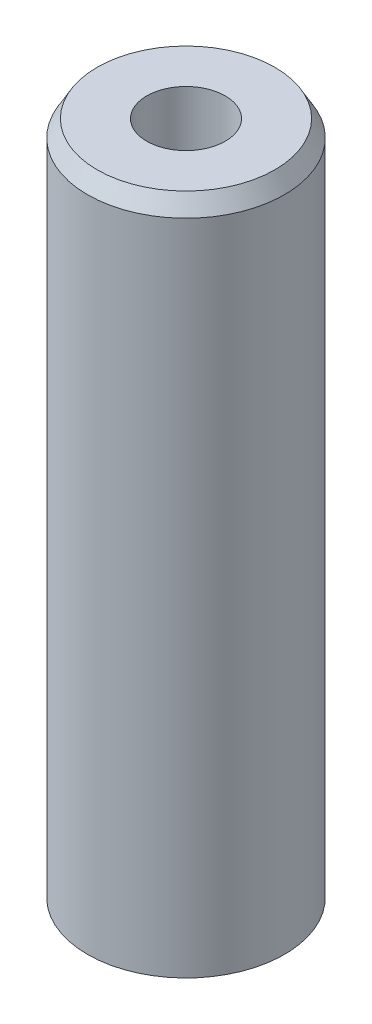
from build123d import *
from OCP.BRepFilletAPI import BRepFilletAPI_MakeChamfer

# Parameters (mm, degrees)
SKETCH1_R           = 35
BOSS_EXTRUDE1_DEPTH = 243.176926841
SKETCH2_R           = 13.965263934
CUT_EXTRUDE1_DEPTH  = 249.163288477
CHAMFER1_SIZE       = 5.941292653
CHAMFER1_SIZE2      = 3.430206912


with BuildPart() as part:
    # Sketch1 → Boss-Extrude1 (new body)
    with BuildSketch(Plane(origin=(0, 0, 0), x_dir=(1, 0, 0), z_dir=(0, 1, 0))):
        Circle(SKETCH1_R)
    extrude(amount=BOSS_EXTRUDE1_DEPTH)

    # Sketch2 → Cut-Extrude1 (cut, through all)
    with BuildSketch(Plane(origin=(0, 0, 0), x_dir=(1, 0, 0), z_dir=(0, 1, 0))):
        Circle(SKETCH2_R)
    extrude(amount=CUT_EXTRUDE1_DEPTH, mode=Mode.SUBTRACT)

    # Chamfer1: one chamfer whose edges measure the first distance from different faces: ONE call of the kernel's chamfer builder (chamfer() names one face for all edges)
    chamfer1_edges_1 = [part.edges().sort_by_distance(p)[0] for p in [
        (-35, 243.176926841, 0),
    ]]
    chamfer1_side_1 = [part.faces().sort_by_distance(p)[0] for p in [
        (-35, 121.58846342, 0),
    ]]
    chamfer1_edges_2 = [part.edges().sort_by_distance(p)[0] for p in [
        (-35, 0, 0),
    ]]
    chamfer1_side_2 = [part.faces().sort_by_distance(p)[0] for p in [
        (-34.010050506, 0, 0),
    ]]
    chamfer1 = BRepFilletAPI_MakeChamfer(part.part.solid().wrapped)
    for e in chamfer1_edges_1:
        chamfer1.Add(CHAMFER1_SIZE, CHAMFER1_SIZE2, e.wrapped, chamfer1_side_1[0].wrapped)  # the first distance lies on this face
    for e in chamfer1_edges_2:
        chamfer1.Add(CHAMFER1_SIZE, CHAMFER1_SIZE2, e.wrapped, chamfer1_side_2[0].wrapped)  # the first distance lies on this face
    add(Compound.cast(chamfer1.Shape()), mode=Mode.REPLACE)


solid = part.part
